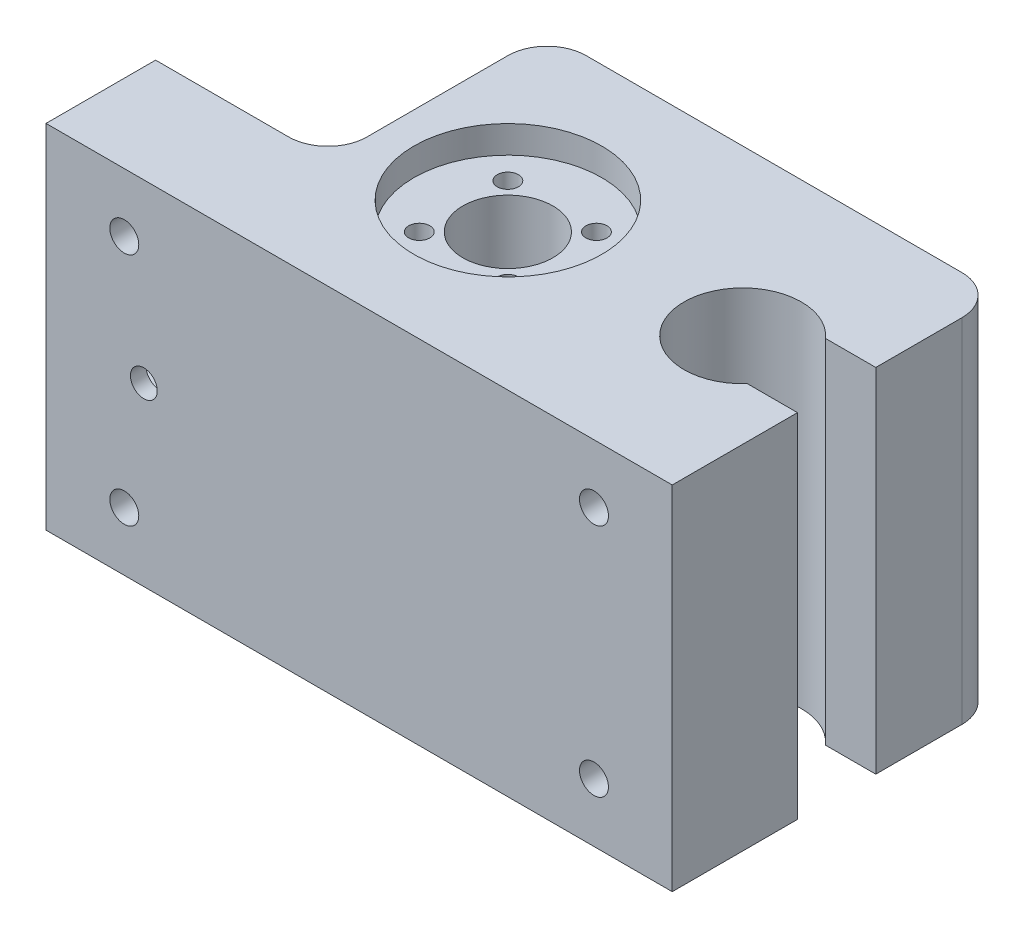
from build123d import *

# Parameters (mm, degrees)
SKETCH1_W           = 80
SKETCH1_H           = 45
BOSS_EXTRUDE1_DEPTH = 42
SKETCH3_W           = 22
SKETCH3_H           = 28
CUT_EXTRUDE2_DEPTH  = 101.940576578
SKETCH4_W           = 10
SKETCH4_H           = 17
CUT_EXTRUDE3_DEPTH  = 28
SKETCH7_R           = 12
CUT_EXTRUDE5_DEPTH  = 3.5
SKETCH11_R          = 1.35
CUT_EXTRUDE6_DEPTH  = 15
SKETCH12_R          = 5.75
CUT_EXTRUDE7_DEPTH  = 100.429623352
SKETCH13_R          = 7.5
CUT_EXTRUDE8_DEPTH  = 101.940576578
SKETCH14_W          = 12.099538741
SKETCH14_H          = 10
CUT_EXTRUDE9_DEPTH  = 101.940576578
SKETCH15_R          = 1.712332532
CUT_EXTRUDE10_DEPTH = 101.940576578
SKETCH16_R          = 1.85
CUT_EXTRUDE11_DEPTH = 8
FILLET2_R           = 5
SKETCH17_R          = 12.5
CUT_EXTRUDE12_DEPTH = 31


with BuildPart() as part:
    # Sketch1 → Boss-Extrude1 (new body)
    with BuildSketch(Plane.XY):
        with Locations((40, 22.5)):
            Rectangle(SKETCH1_W, SKETCH1_H)
    extrude(amount=BOSS_EXTRUDE1_DEPTH)

    # Sketch3 → Cut-Extrude2 (cut, through all)
    with BuildSketch(Plane(origin=(0, 45, 0), x_dir=(1, 0, 0), z_dir=(0, 1, 0))):
        with Locations((11, -14)):
            Rectangle(SKETCH3_W, SKETCH3_H)
    extrude(amount=-CUT_EXTRUDE2_DEPTH, mode=Mode.SUBTRACT)

    # Sketch4 → Cut-Extrude3 (cut)
    with BuildSketch(Plane.ZY):
        with Locations((35, 22.5)):
            Rectangle(SKETCH4_W, SKETCH4_H)
    extrude(amount=-CUT_EXTRUDE3_DEPTH, mode=Mode.SUBTRACT)

    # Sketch7 → Cut-Extrude5 (cut)
    with BuildSketch(Plane(origin=(0, 45, 0), x_dir=(1, 0, 0), z_dir=(0, 1, 0))):
        with Locations((38, -21)):
            Circle(SKETCH7_R)
    extrude(amount=-CUT_EXTRUDE5_DEPTH, mode=Mode.SUBTRACT)

    # Sketch11 → Cut-Extrude6 (cut)
    with BuildSketch(Plane(origin=(0, 41.5, 0), x_dir=(1, 0, 0), z_dir=(0, 1, 0))):
        with Locations((43.656854249, -15.343145751)):
            Circle(SKETCH11_R)
        with Locations((43.656854249, -26.656854249)):
            Circle(SKETCH11_R)
        with Locations((32.343145751, -26.656854249)):
            Circle(SKETCH11_R)
        with Locations((32.343145751, -15.343145751)):
            Circle(SKETCH11_R)
    extrude(amount=-CUT_EXTRUDE6_DEPTH, mode=Mode.SUBTRACT)

    # Sketch12 → Cut-Extrude7 (cut, through all)
    with BuildSketch(Plane(origin=(0, 41.5, 0), x_dir=(1, 0, 0), z_dir=(0, 1, 0))):
        with Locations((38, -21)):
            Circle(SKETCH12_R)
    extrude(amount=-CUT_EXTRUDE7_DEPTH, mode=Mode.SUBTRACT)

    # Sketch13 → Cut-Extrude8 (cut, through all)
    with BuildSketch(Plane(origin=(0, 45, 0), x_dir=(1, 0, 0), z_dir=(0, 1, 0))):
        with Locations((68, -21)):
            Circle(SKETCH13_R)
    extrude(amount=-CUT_EXTRUDE8_DEPTH, mode=Mode.SUBTRACT)

    # Sketch14 → Cut-Extrude9 (cut, through all)
    with BuildSketch(Plane(origin=(0, 45, 0), x_dir=(1, 0, 0), z_dir=(0, 1, 0))):
        with Locations((73.950230629, -21)):
            Rectangle(SKETCH14_W, SKETCH14_H)
    extrude(amount=-CUT_EXTRUDE9_DEPTH, mode=Mode.SUBTRACT)

    # Sketch15 → Cut-Extrude10 (cut, through all)
    with BuildSketch(Plane.XY.offset(42)):
        with Locations((12.5, 22.500000001)):
            Circle(SKETCH15_R)
    extrude(amount=-CUT_EXTRUDE10_DEPTH, mode=Mode.SUBTRACT)

    # Sketch16 → Cut-Extrude11 (cut)
    with BuildSketch(Plane.XY.offset(42)):
        with Locations((10, 37.5)):
            Circle(SKETCH16_R)
        with Locations((70, 37.5)):
            Circle(SKETCH16_R)
        with Locations((70, 7.5)):
            Circle(SKETCH16_R)
        with Locations((10, 7.5)):
            Circle(SKETCH16_R)
    extrude(amount=-CUT_EXTRUDE11_DEPTH, mode=Mode.SUBTRACT)

    # Fillet2
    fillet2_edges = [part.edges().sort_by_distance(p)[0] for p in [
        (22, 22.5, 28),
        (22, 22.5, 0),
        (80, 22.5, 0),
    ]]
    fillet(fillet2_edges, radius=FILLET2_R)

    # Sketch17 → Cut-Extrude12 (cut)
    with BuildSketch(Plane.XZ):
        with Locations((38, 21)):
            Circle(SKETCH17_R)
    extrude(amount=-CUT_EXTRUDE12_DEPTH, mode=Mode.SUBTRACT)


solid = part.part
